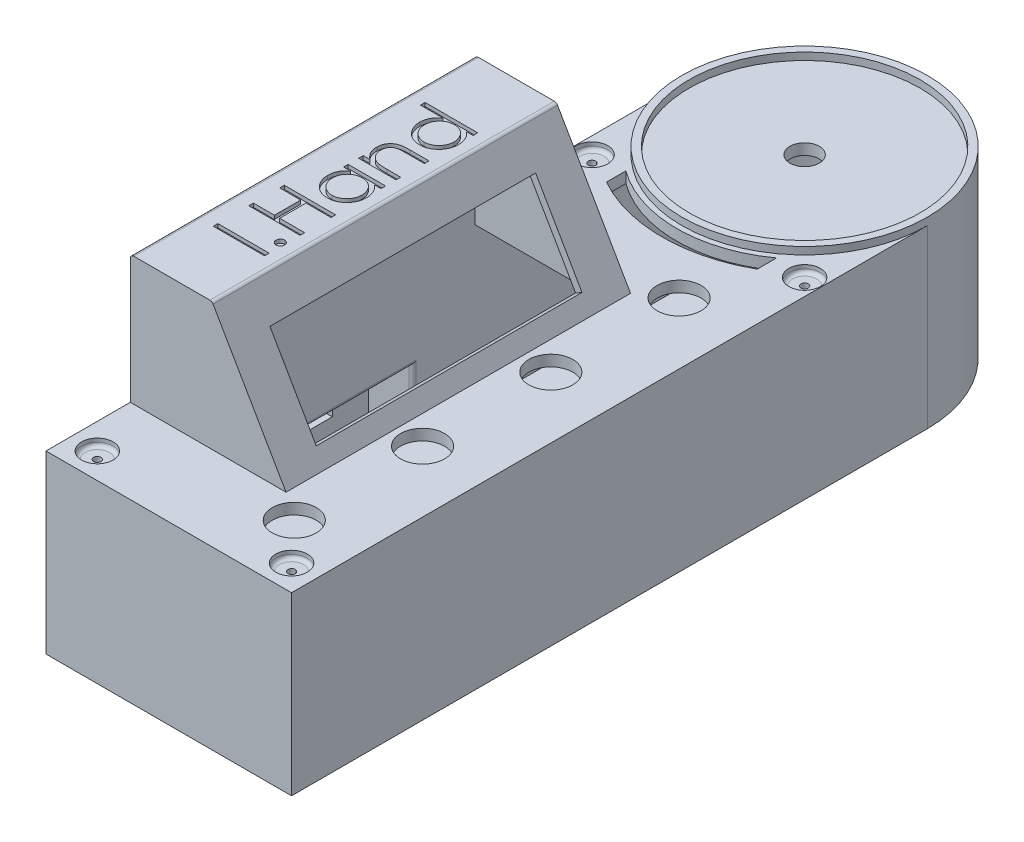
from build123d import *

# Parameters (mm, degrees)
SKETCH4_W                = 63
SKETCH4_H                = 43
BOSS_EXTRUDE2_DEPTH      = 173.5
SKETCH6_R                = 4
CUT_EXTRUDE1_DEPTH       = 3
SKETCH9_W                = 63
SKETCH9_H                = 43
CUT_EXTRUDE2_DEPTH       = 173.5
SKETCH10_R               = 8.2
BOSS_EXTRUDE3_DEPTH      = 22.8
SKETCH11_W               = 63
SKETCH11_H               = 43
BOSS_EXTRUDE4_DEPTH      = 2
SKETCH13_R               = 3
BOSS_EXTRUDE5_DEPTH      = 43
SKETCH14_R               = 1
CUT_EXTRUDE3_DEPTH       = 46
SKETCH15_R               = 4.3
CUT_EXTRUDE4_DEPTH       = 2
FILLET1_R                = 1
SKETCH19_R               = 6
CUT_EXTRUDE5_DEPTH       = 3
BOSS_EXTRUDE6_DEPTH      = 94
SKETCH21_W               = 37.035898385
SKETCH21_H               = 94
CUT_EXTRUDE6_DEPTH       = 13
FILLET2_R                = 1
BOSS_EXTRUDE8_DEPTH      = 2
SKETCH23_W               = 72.5
SKETCH23_H               = 25.3
CUT_EXTRUDE7_DEPTH       = 2
BOSS_EXTRUDE9_START      = -2
BOSS_EXTRUDE9_DEPTH      = 2
SKETCH25_R               = 3
BOSS_EXTRUDE10_DEPTH     = 48
SKETCH26_R               = 1
CUT_EXTRUDE8_DEPTH       = 46
SKETCH27_R               = 4.3
CUT_EXTRUDE9_DEPTH       = 2
FILLET3_R                = 1
SKETCH30_W               = 56
SKETCH30_H               = 18
CUT_EXTRUDE10_DEPTH      = 2
SKETCH31_W               = 60
SKETCH31_H               = 22
SKETCH31_W_2             = 56
SKETCH31_H_2             = 18
BOSS_EXTRUDE11_DEPTH     = 12
FILLET4_R                = 1
SKETCH33_W               = 56
SKETCH33_H               = 18
BOSS_EXTRUDE12_DEPTH     = 2
SKETCH34_W               = 1.256410256
SKETCH34_H               = 14
CUT_EXTRUDE11_DEPTH      = 1
SKETCH35_W               = 13.1
SKETCH35_H               = 12
SKETCH35_W_2             = 9.9
SKETCH35_H_2             = 11.8
CUT_EXTRUDE12_DEPTH      = 2
FILLET5_R                = 1
CUT_EXTRUDE13_DEPTH      = 186.67848556
CUT_EXTRUDE13_DEPTH_BACK = 3
FILLET6_R                = 1
SKETCH37_W               = 140.841687605
SKETCH37_H               = 2
BOSS_EXTRUDE13_DEPTH     = 4
FILLET8_R                = 2


with BuildPart() as part:
    # Sketch1 → Revolve1 (revolve)
    with BuildSketch(Plane.XY, mode=Mode.PRIVATE) as revolve1_sk:
        Polygon((-31.5, 48), (-31.5, 50), (-33.5, 50), (-33.5, 0), (0, 0), (0, 24.8), (-8.2, 24.8), (-8.2, 2), (-31.5, 2), (-31.5, 45), (-4, 45), (-4, 48), align=None)
    revolve(revolve1_sk.sketch.rotate(Axis((0, 0, 0), (0, 1, 0)), 270), axis=Axis((0, 0, 0), (0, 1, 0)))

    # Sketch4 → Boss-Extrude2 (add)
    with BuildSketch(Plane.XY):
        Polygon((33.5, 0), (-33.5, 0), (-33.5, 48), (-31.5, 48), (31.5, 48), (33.5, 48), align=None)
        with Locations((0, 23.5)):
            Rectangle(SKETCH4_W, SKETCH4_H, mode=Mode.SUBTRACT)
    extrude(amount=BOSS_EXTRUDE2_DEPTH)

    # Sketch6 → Cut-Extrude1 (cut)
    with BuildSketch(Plane(origin=(0, 48, 0), x_dir=(1, 0, 0), z_dir=(0, 1, 0))):
        with Locations(Location((0, 0, 0), (0, 0, 90))):
            Circle(SKETCH6_R)
    extrude(amount=-CUT_EXTRUDE1_DEPTH, mode=Mode.SUBTRACT)

    # Sketch9 → Cut-Extrude2 (cut)
    with BuildSketch(Plane.XY.offset(173.5)):
        with Locations((0, 23.5)):
            Rectangle(SKETCH9_W, SKETCH9_H)
    extrude(amount=-CUT_EXTRUDE2_DEPTH, mode=Mode.SUBTRACT)

    # Sketch10 → Boss-Extrude3 (add)
    with BuildSketch(Plane(origin=(0, 2, 0), x_dir=(1, 0, 0), z_dir=(0, 1, 0))):
        with Locations(Location((0, 0, 0), (0, 0, 90))):
            Circle(SKETCH10_R)
    extrude(amount=BOSS_EXTRUDE3_DEPTH)

    # Sketch11 → Boss-Extrude4 (add)
    with BuildSketch(Plane.XY.offset(173.5)):
        with Locations((0, 23.5)):
            Rectangle(SKETCH11_W, SKETCH11_H)
    extrude(amount=-BOSS_EXTRUDE4_DEPTH)

    # Sketch13 → Boss-Extrude5 (add)
    with BuildSketch(Plane(origin=(0, 2, 0), x_dir=(1, 0, 0), z_dir=(0, 1, 0))):
        with Locations(Location((-26.5, -166.5, 0), (0, 0, 90))):
            Circle(SKETCH13_R)
        with Locations(Location((26.5, -166.5, 0), (0, 0, 90))):
            Circle(SKETCH13_R)
    extrude(amount=BOSS_EXTRUDE5_DEPTH)

    # Sketch14 → Cut-Extrude3 (cut)
    with BuildSketch(Plane(origin=(0, 2, 0), x_dir=(1, 0, 0), z_dir=(0, 1, 0))):
        with Locations(Location((-26.5, -166.5, 0), (0, 0, 270))):
            Circle(SKETCH14_R)
        with Locations(Location((26.5, -166.5, 0), (0, 0, 270))):
            Circle(SKETCH14_R)
    extrude(amount=CUT_EXTRUDE3_DEPTH, mode=Mode.SUBTRACT)

    # Sketch15 → Cut-Extrude4 (cut)
    with BuildSketch(Plane(origin=(0, 48, 0), x_dir=(1, 0, 0), z_dir=(0, 1, 0))):
        with Locations(Location((-26.5, -166.5, 0), (0, 0, 270))):
            Circle(SKETCH15_R)
        with Locations(Location((26.5, -166.5, 0), (0, 0, 270))):
            Circle(SKETCH15_R)
    extrude(amount=-CUT_EXTRUDE4_DEPTH, mode=Mode.SUBTRACT)

    # Fillet1
    fillet1_edges = [part.edges().sort_by_distance(p)[0] for p in [
        (-26.5, 46, 162.2),
        (26.5, 46, 162.2),
    ]]
    fillet(fillet1_edges, radius=FILLET1_R)

    # Sketch19 → Cut-Extrude5 (cut)
    with BuildSketch(Plane(origin=(0, 48, 0), x_dir=(1, 0, 0), z_dir=(0, 1, 0))):
        with Locations(Location((16.75, -51, 0), (0, 0, 270))):
            Circle(SKETCH19_R)
        with Locations(Location((16.75, -86, 0), (0, 0, 270))):
            Circle(SKETCH19_R)
        with Locations(Location((16.75, -121, 0), (0, 0, 270))):
            Circle(SKETCH19_R)
        with Locations(Location((16.75, -156, 0), (0, 0, 270))):
            Circle(SKETCH19_R)
    extrude(amount=-CUT_EXTRUDE5_DEPTH, mode=Mode.SUBTRACT)

    # Sketch20 → Boss-Extrude6 (add)
    with BuildSketch(Plane.XY.offset(56.5)):
        Polygon((9, 48), (-11.207259422, 83), (-33.5, 83), (-33.5, 48), align=None)
        Polygon((5.535898385, 50), (-12.36195996, 81), (-31.5, 81), (-31.5, 50), align=None, mode=Mode.SUBTRACT)
    extrude(amount=BOSS_EXTRUDE6_DEPTH)

    # Sketch21 → Cut-Extrude6 (cut)
    with BuildSketch(Plane(origin=(0, 50, 0), x_dir=(1, 0, 0), z_dir=(0, 1, 0))):
        with Locations((-12.982050808, -103.5)):
            Rectangle(SKETCH21_W, SKETCH21_H)
    extrude(amount=-CUT_EXTRUDE6_DEPTH, mode=Mode.SUBTRACT)

    # Fillet2
    fillet2_edges = [part.edges().sort_by_distance(p)[0] for p in [
        (-11.207259422, 83, 103.5),
        (-33.5, 83, 103.5),
    ]]
    fillet(fillet2_edges, radius=FILLET2_R)

    # Sketch22 → Boss-Extrude8 (add)
    with BuildSketch(Plane.XY.offset(150.5)):
        with BuildLine():
            Line((-33.5, 48), (-33.5, 45))
            Line((-33.5, 45), (9, 45))
            Line((9, 45), (9, 48))
            Line((9, 48), (-10.918584287, 82.5))
            ThreePointArc((-10.918584287, 82.5), (-11.284609691, 82.866025404), (-11.784609691, 83))
            Line((-11.784609691, 83), (-32.5, 83))
            ThreePointArc((-32.5, 83), (-33.207106781, 82.707106781), (-33.5, 82))
            Line((-33.5, 82), (-33.5, 48))
        make_face()
    extrude(amount=-BOSS_EXTRUDE8_DEPTH)

    # Sketch23 → Cut-Extrude7 (cut)
    with BuildSketch(Plane(origin=(27.534609691, 15.897114317, 0), x_dir=(0, 0, -1), z_dir=(0.8660254037844364, 0.5000000000000041, 0))):
        with Locations((-103.5, 54.719219382)):
            Rectangle(SKETCH23_W, SKETCH23_H)
    extrude(amount=-CUT_EXTRUDE7_DEPTH, mode=Mode.SUBTRACT)

    # Sketch24 → Boss-Extrude9 (add)
    with BuildSketch(Plane(origin=(0, 0, 56.5), x_dir=(-1, 0, 0), z_dir=(0, 0, -1)).offset(BOSS_EXTRUDE9_START)):
        with BuildLine():
            Line((-9, 48), (-9, 45))
            Line((-9, 45), (33.5, 45))
            Line((33.5, 45), (33.5, 82))
            ThreePointArc((33.5, 82), (33.207106781, 82.707106781), (32.5, 83))
            Line((32.5, 83), (11.784609691, 83))
            ThreePointArc((11.784609691, 83), (11.284609691, 82.866025404), (10.918584287, 82.5))
            Line((10.918584287, 82.5), (-9, 48))
        make_face()
    extrude(amount=BOSS_EXTRUDE9_DEPTH)

    # Sketch25 → Boss-Extrude10 (add)
    with BuildSketch(Plane(origin=(0, 48, 0), x_dir=(1, 0, 0), z_dir=(0, 1, 0))):
        with Locations((29, -29)):
            Circle(SKETCH25_R)
        with Locations((-29, -29)):
            Circle(SKETCH25_R)
    extrude(amount=-BOSS_EXTRUDE10_DEPTH)

    # Sketch26 → Cut-Extrude8 (cut)
    with BuildSketch(Plane(origin=(0, 48, 0), x_dir=(1, 0, 0), z_dir=(0, 1, 0))):
        with Locations(Location((29, -29, 0), (0, 0, 270))):
            Circle(SKETCH26_R)
        with Locations(Location((-29, -29, 0), (0, 0, 270))):
            Circle(SKETCH26_R)
    extrude(amount=-CUT_EXTRUDE8_DEPTH, mode=Mode.SUBTRACT)

    # Sketch27 → Cut-Extrude9 (cut)
    with BuildSketch(Plane(origin=(0, 48, 0), x_dir=(1, 0, 0), z_dir=(0, 1, 0))):
        with Locations(Location((-29, -29, 0), (0, 0, 270))):
            Circle(SKETCH27_R)
        with Locations(Location((29, -29, 0), (0, 0, 270))):
            Circle(SKETCH27_R)
    extrude(amount=-CUT_EXTRUDE9_DEPTH, mode=Mode.SUBTRACT)

    # Fillet3
    fillet3_edges = [part.edges().sort_by_distance(p)[0] for p in [
        (-29, 46, 24.7),
        (29, 46, 24.7),
    ]]
    fillet(fillet3_edges, radius=FILLET3_R)

    # Sketch30 → Cut-Extrude10 (cut)
    with BuildSketch(Plane.ZY.offset(33.5)):
        with Locations((103.5, 11)):
            Rectangle(SKETCH30_W, SKETCH30_H)
    extrude(amount=-CUT_EXTRUDE10_DEPTH, mode=Mode.SUBTRACT)

    # Sketch31 → Boss-Extrude11 (add)
    with BuildSketch(Plane.ZY.offset(33.5)):
        with Locations((103.5, 11)):
            Rectangle(SKETCH31_W, SKETCH31_H)
        with Locations((103.5, 11)):
            Rectangle(SKETCH31_W_2, SKETCH31_H_2, mode=Mode.SUBTRACT)
    extrude(amount=BOSS_EXTRUDE11_DEPTH)

    # Fillet4
    fillet4_edges = [part.edges().sort_by_distance(p)[0] for p in [
        (-33.5, 22, 103.5),
        (-33.5, 11, 73.5),
        (-33.5, 11, 133.5),
    ]]
    fillet(fillet4_edges, radius=FILLET4_R)

    # Sketch33 → Boss-Extrude12 (add)
    with BuildSketch(Plane.ZY.offset(45.5)):
        with Locations((103.5, 11)):
            Rectangle(SKETCH33_W, SKETCH33_H)
    extrude(amount=-BOSS_EXTRUDE12_DEPTH)

    # Sketch34 → Cut-Extrude11 (cut)
    # profile 1 of 6: a face of its own
    with BuildSketch(Plane(origin=(-88.690997647, 83, 0), x_dir=(0, 0, -1), z_dir=(0, -1, 0))):
        with Locations((-131.948717949, 66.906387956)):
            Rectangle(SKETCH34_W, SKETCH34_H)
    # profile 2 of 6: a face of its own
    with BuildSketch(Plane(origin=(-88.690997647, 83, 0), x_dir=(0, 0, -1), z_dir=(0, -1, 0))):
        with BuildLine():
            add(Edge.make_bspline(
                [(-127.282051282, 71.752541802), (-127.204036474, 71.757021384), (-127.05199672, 71.765751451), (-126.831838559, 71.829913099), (-126.630653738, 71.938172272), (-126.452556555, 72.086921483), (-126.304534975, 72.264507803), (-126.195030127, 72.46518156), (-126.127927486, 72.68597799), (-126.119633012, 72.84021095), (-126.115384615, 72.919208469)],
                knots=[0, 0, 0, 0, 1.020591893, 1.988988293, 2.974634352, 3.991697318, 5.008760285, 5.983632262, 6.967224335, 8, 8, 8, 8], degree=3))
            add(Edge.make_bspline(
                [(-126.115384615, 72.919208469), (-126.119787901, 72.996319721), (-126.128486105, 73.148644483), (-126.195061577, 73.367578068), (-126.30439614, 73.56847965), (-126.453493838, 73.745645733), (-126.6295776, 73.897974931), (-126.832476342, 74.004732003), (-127.051429094, 74.073595456), (-127.203934167, 74.081715722), (-127.282051282, 74.085875135)],
                knots=[0, 0, 0, 0, 1.010056097, 1.99525427, 2.971718109, 3.990441831, 5.01702829, 6.004283803, 6.977741589, 8, 8, 8, 8], degree=3))
            add(Edge.make_bspline(
                [(-127.282051282, 74.085875135), (-127.360112179, 74.081559045), (-127.513404007, 74.073083337), (-127.73317612, 74.006101082), (-127.934845679, 73.896933206), (-128.11097521, 73.745920643), (-128.258874388, 73.567557044), (-128.373284839, 73.368945884), (-128.434548495, 73.148011315), (-128.443950276, 72.996195002), (-128.448717949, 72.919208469)],
                knots=[0, 0, 0, 0, 1.021821805, 2.006599202, 2.982645994, 4.008793999, 5.027082625, 6.009034913, 6.990375297, 8, 8, 8, 8], degree=3))
            add(Edge.make_bspline(
                [(-128.448717949, 72.919208469), (-128.444092294, 72.840340078), (-128.435076647, 72.686621378), (-128.373312706, 72.463815008), (-128.258735298, 72.265431373), (-128.111909392, 72.086648721), (-127.933780412, 71.939197607), (-127.733801774, 71.828562965), (-127.51284526, 71.76625627), (-127.360012131, 71.757174469), (-127.282051282, 71.752541802)],
                knots=[0, 0, 0, 0, 1.032329927, 2.012066096, 2.992413168, 4.009037178, 5.025661188, 6.000112418, 6.979848586, 8, 8, 8, 8], degree=3))
        make_face()
    # profile 3 of 6: a face of its own
    with BuildSketch(Plane(origin=(-88.690997647, 83, 0), x_dir=(0, 0, -1), z_dir=(0, -1, 0))):
        Polygon((-122.884615385, 59.906387956), (-121.628205128, 59.906387956), (-121.628205128, 65.649977699), (-114.448717949, 65.649977699), (-114.448717949, 59.906387956), (-113.192307692, 59.906387956), (-113.192307692, 73.906387956), (-114.448717949, 73.906387956), (-114.448717949, 67.085875135), (-121.628205128, 67.085875135), (-121.628205128, 73.906387956), (-122.884615385, 73.906387956), align=None)
    # profile 4 of 6: a face of its own
    with BuildSketch(Plane(origin=(-88.690997647, 83, 0), x_dir=(0, 0, -1), z_dir=(0, -1, 0))):
        with BuildLine():
            Line((-99.551282051, 63.675618725), (-99.551282051, 73.906387956))
            Line((-99.551282051, 73.906387956), (-100.807692308, 73.906387956))
            Line((-100.807692308, 73.906387956), (-100.807692308, 72.136756545))
            add(Edge.make_bspline(
                [(-100.807692308, 72.136756545), (-100.949559408, 72.296694095), (-101.226826553, 72.609278391), (-101.685478933, 73.020163), (-102.175666693, 73.355630058), (-102.689038567, 73.627929327), (-103.229568228, 73.833193668), (-103.794081172, 73.977799853), (-104.382135708, 74.071868231), (-104.783157032, 74.081164279), (-104.986378205, 74.085875135)],
                knots=[0, 0, 0, 0, 1.074235403, 2.099501444, 3.086304576, 4.053325556, 5.01427503, 5.985443889, 6.979105517, 8, 8, 8, 8], degree=3))
            add(Edge.make_bspline(
                [(-104.986378205, 74.085875135), (-105.167050511, 74.08097046), (-105.523344299, 74.071298224), (-106.047453548, 73.996237304), (-106.551848614, 73.875758039), (-107.036850958, 73.707995401), (-107.499174292, 73.486612277), (-107.941423686, 73.21870812), (-108.36463127, 72.902801794), (-108.760748522, 72.540247251), (-109.125978444, 72.14687795), (-109.445517738, 71.726092193), (-109.716337693, 71.283669461), (-109.938903193, 70.8197341), (-110.111136046, 70.334625248), (-110.23096351, 69.828675698), (-110.305943543, 69.302727324), (-110.315610879, 68.944567704), (-110.320512821, 68.762958469)],
                knots=[0, 0, 0, 0, 1.034036272, 2.039165313, 3.024406509, 3.999331371, 4.971254918, 5.953351348, 6.95522652, 7.989525907, 9.023492927, 10.024309745, 11.009187477, 11.988246066, 12.964946762, 13.950187958, 14.960617622, 16, 16, 16, 16], degree=3))
            add(Edge.make_bspline(
                [(-110.320512821, 68.762958469), (-110.315502156, 68.585102896), (-110.305596342, 68.233492024), (-110.23176582, 67.716388188), (-110.107706917, 67.2182747), (-109.933274241, 66.740996758), (-109.710590389, 66.282632207), (-109.435112943, 65.846767298), (-109.115688796, 65.426734526), (-108.74655549, 65.036003596), (-108.34688294, 64.676390503), (-107.921307552, 64.359716463), (-107.475135823, 64.092499188), (-107.007473118, 63.875277522), (-106.5216309, 63.702659962), (-106.013918487, 63.582328903), (-105.48664475, 63.511593502), (-105.128686543, 63.501335053), (-104.947115385, 63.496131545)],
                knots=[0, 0, 0, 0, 1.02050356, 2.017480486, 2.990790918, 3.96161403, 4.928589988, 5.909588639, 6.91611943, 7.952353252, 8.989586576, 9.99823133, 10.991940466, 11.968822692, 12.952985106, 13.945868367, 14.958059758, 16, 16, 16, 16], degree=3))
            add(Edge.make_bspline(
                [(-104.947115385, 63.496131545), (-104.738311782, 63.501860959), (-104.328857772, 63.513096067), (-103.729112136, 63.607392592), (-103.161484658, 63.765224909), (-102.621058799, 63.980649759), (-102.115429291, 64.270750367), (-101.639735311, 64.629702222), (-101.199621142, 65.066207485), (-100.9405952, 65.398270363), (-100.807692308, 65.568647571)],
                knots=[0, 0, 0, 0, 1.038908319, 2.037250181, 3.012632028, 3.966567879, 4.9252131, 5.905168122, 6.925168603, 8, 8, 8, 8], degree=3))
            Line((-100.807692308, 65.568647571), (-100.807692308, 63.675618725))
            Line((-100.807692308, 63.675618725), (-99.551282051, 63.675618725))
        make_face()
        with BuildLine():
            add(Edge.make_bspline(
                [(-104.930288462, 64.752541802), (-105.113941971, 64.759081875), (-105.476444788, 64.771990938), (-106.008676356, 64.872605062), (-106.517721233, 65.040443519), (-107.002751616, 65.268659247), (-107.450376696, 65.560996553), (-107.857064896, 65.905684904), (-108.211791596, 66.306947393), (-108.511723002, 66.755564948), (-108.760721655, 67.233621452), (-108.932550065, 67.737000467), (-109.046679273, 68.252096677), (-109.058279678, 68.601563937), (-109.064102564, 68.776980904)],
                knots=[0, 0, 0, 0, 1.031179624, 2.035384561, 3.030098214, 4.035455833, 5.037557836, 6.024646278, 7.02156144, 8.035264006, 9.049836703, 10.039645228, 11.015989397, 12, 12, 12, 12], degree=3))
            add(Edge.make_bspline(
                [(-109.064102564, 68.776980904), (-109.05654374, 68.951306689), (-109.04145572, 69.299274959), (-108.936056281, 69.815160534), (-108.751049717, 70.315255398), (-108.507497803, 70.799474277), (-108.202845091, 71.251438033), (-107.848818519, 71.660109619), (-107.440066701, 72.010111329), (-106.988500009, 72.303274908), (-106.506714423, 72.539101452), (-105.999879604, 72.705430661), (-105.476829524, 72.810449466), (-105.120547678, 72.823105087), (-104.94150641, 72.829464879)],
                knots=[0, 0, 0, 0, 0.979235476, 1.954632679, 2.943119654, 3.967171814, 4.992637064, 5.997548408, 6.995574264, 8.005058949, 9.015076297, 9.999929117, 10.994910263, 12, 12, 12, 12], degree=3))
            add(Edge.make_bspline(
                [(-104.94150641, 72.829464879), (-104.759723293, 72.82284818), (-104.399094225, 72.809721692), (-103.865022351, 72.708413684), (-103.347692816, 72.538491195), (-102.851318684, 72.307106954), (-102.389689733, 72.020246776), (-101.97729874, 71.682924863), (-101.621032586, 71.296628225), (-101.327706123, 70.863665084), (-101.093342241, 70.394243496), (-100.927394835, 69.892855662), (-100.826604225, 69.362481009), (-100.814083445, 68.998983698), (-100.807692308, 68.813439238)],
                knots=[0, 0, 0, 0, 1.017730373, 2.019016736, 3.032373701, 4.060729657, 5.079187105, 6.068726676, 7.03591854, 8.011858086, 8.988317194, 9.965225429, 10.961364673, 12, 12, 12, 12], degree=3))
            add(Edge.make_bspline(
                [(-100.807692308, 68.813439238), (-100.811530994, 68.67208797), (-100.819086743, 68.393863944), (-100.876808154, 67.985353095), (-100.968631033, 67.594421044), (-101.098004164, 67.220639903), (-101.268012245, 66.866138453), (-101.472841465, 66.528137895), (-101.716693177, 66.209786658), (-101.992146351, 65.911487906), (-102.297054473, 65.64077053), (-102.621284743, 65.402162507), (-102.964021402, 65.200234462), (-103.325023868, 65.038639209), (-103.701511674, 64.906991608), (-104.097093385, 64.820040643), (-104.507782261, 64.760144848), (-104.787970212, 64.755102835), (-104.930288462, 64.752541802)],
                knots=[0, 0, 0, 0, 1.050062701, 2.066855696, 3.059271411, 4.030305351, 4.999747758, 5.975466543, 6.961907836, 7.974539719, 8.98812422, 9.98710676, 10.961662635, 11.93785114, 12.922015094, 13.919620009, 14.94329489, 16, 16, 16, 16], degree=3))
        make_face(mode=Mode.SUBTRACT)
    # profile 5 of 6: a face of its own
    with BuildSketch(Plane(origin=(-88.690997647, 83, 0), x_dir=(0, 0, -1), z_dir=(0, -1, 0))):
        with BuildLine():
            Line((-96.679487179, 63.675618725), (-95.423076923, 63.675618725))
            Line((-95.423076923, 63.675618725), (-95.423076923, 65.520971289))
            add(Edge.make_bspline(
                [(-95.423076923, 65.520971289), (-95.289157957, 65.353350137), (-95.029691705, 65.02858634), (-94.59314516, 64.60509757), (-94.137956996, 64.249722748), (-93.656734238, 63.969916172), (-93.154428772, 63.758297763), (-92.632465882, 63.605695951), (-92.088020434, 63.514140011), (-91.717760861, 63.502181358), (-91.530448718, 63.496131545)],
                knots=[0, 0, 0, 0, 1.127869841, 2.185233117, 3.191641716, 4.159226741, 5.10472073, 6.052603964, 7.014823782, 8, 8, 8, 8], degree=3))
            add(Edge.make_bspline(
                [(-91.530448718, 63.496131545), (-91.341035811, 63.502717968), (-90.970123229, 63.515615649), (-90.432020324, 63.629261075), (-89.925930257, 63.809105693), (-89.458620286, 64.061868442), (-89.037280928, 64.375689687), (-88.671907889, 64.743804343), (-88.364647734, 65.161777592), (-88.15956584, 65.553010358), (-88.02692105, 65.900525254), (-87.939752105, 66.197763901), (-87.869230571, 66.529058154), (-87.806040534, 66.893588904), (-87.763885841, 67.292820282), (-87.730470414, 67.725799431), (-87.706569282, 68.192451381), (-87.705618498, 68.515197399), (-87.705128205, 68.68162834)],
                knots=[0, 0, 0, 0, 1.235764162, 2.419900973, 3.574701258, 4.732869372, 5.875730734, 6.993815468, 8.107424371, 9.251605764, 9.866123335, 10.534503958, 11.272175692, 12.077112099, 12.949509943, 13.89253218, 14.913238789, 16, 16, 16, 16], degree=3))
            Line((-87.705128205, 68.68162834), (-87.705128205, 73.906387956))
            Line((-87.705128205, 73.906387956), (-88.961538462, 73.906387956))
            Line((-88.961538462, 73.906387956), (-88.961538462, 69.093887956))
            add(Edge.make_bspline(
                [(-88.961538462, 69.093887956), (-88.962308095, 68.954597976), (-88.963780274, 68.68815995), (-88.968484365, 68.306686454), (-88.979557576, 67.961664657), (-88.995757207, 67.652102998), (-89.018432601, 67.379134492), (-89.042707021, 67.141377431), (-89.07214832, 66.940937808), (-89.098401967, 66.820277635), (-89.110176282, 66.766163597)],
                knots=[0, 0, 0, 0, 1.430803381, 2.736883362, 3.918614142, 4.976458302, 5.92063272, 6.731858525, 7.431260095, 8, 8, 8, 8], degree=3))
            add(Edge.make_bspline(
                [(-89.110176282, 66.766163597), (-89.152467435, 66.60720474), (-89.233648341, 66.302071799), (-89.438328407, 65.888890398), (-89.69079908, 65.534265166), (-90.003604456, 65.245489432), (-90.368343351, 65.020684953), (-90.785622116, 64.864823406), (-91.251122123, 64.767308391), (-91.578541768, 64.757601307), (-91.749198718, 64.752541802)],
                knots=[0, 0, 0, 0, 1.084232, 2.08126119, 3.027460722, 3.945137793, 4.874029258, 5.839697328, 6.874011781, 8, 8, 8, 8], degree=3))
            add(Edge.make_bspline(
                [(-91.749198718, 64.752541802), (-91.850278792, 64.754417715), (-92.050313648, 64.758130098), (-92.346777346, 64.796345108), (-92.635253712, 64.856700904), (-92.914969902, 64.945850548), (-93.186491199, 65.05424406), (-93.450941222, 65.187247995), (-93.70462484, 65.348127535), (-93.951109207, 65.528956343), (-94.180206001, 65.730331925), (-94.396414837, 65.939748523), (-94.58638105, 66.165974926), (-94.758817282, 66.401012527), (-94.907487653, 66.649582736), (-95.037311441, 66.90902848), (-95.147451161, 67.179760147), (-95.202182341, 67.367659979), (-95.229567308, 67.461676417)],
                knots=[0, 0, 0, 0, 1.023939463, 2.026349741, 3.024227553, 4.007104963, 4.997624259, 5.984875705, 7.002218968, 8.038748769, 9.079772093, 10.091408226, 11.086177727, 12.069739863, 13.043026652, 14.017557731, 15.008077027, 16, 16, 16, 16], degree=3))
            add(Edge.make_bspline(
                [(-95.229567308, 67.461676417), (-95.245325902, 67.530697229), (-95.279631537, 67.680951927), (-95.316684257, 67.927529605), (-95.350314558, 68.212769505), (-95.378462393, 68.536338773), (-95.395684059, 68.899370273), (-95.414461646, 69.300313625), (-95.42129789, 69.740767578), (-95.422467306, 70.047414349), (-95.423076923, 70.207269366)],
                knots=[0, 0, 0, 0, 0.615963638, 1.340920617, 2.168419149, 3.115676021, 4.16674242, 5.331190069, 6.6087489, 8, 8, 8, 8], degree=3))
            Line((-95.423076923, 70.207269366), (-95.423076923, 73.906387956))
            Line((-95.423076923, 73.906387956), (-96.679487179, 73.906387956))
            Line((-96.679487179, 73.906387956), (-96.679487179, 63.675618725))
        make_face()
    # profile 6 of 6: a face of its own
    with BuildSketch(Plane(origin=(-88.690997647, 83, 0), x_dir=(0, 0, -1), z_dir=(0, -1, 0))):
        with BuildLine():
            Line((-74.423076923, 59.547413597), (-74.423076923, 73.906387956))
            Line((-74.423076923, 73.906387956), (-75.679487179, 73.906387956))
            Line((-75.679487179, 73.906387956), (-75.679487179, 72.136756545))
            add(Edge.make_bspline(
                [(-75.679487179, 72.136756545), (-75.82135428, 72.296694095), (-76.098621425, 72.609278391), (-76.557273805, 73.020163), (-77.047461565, 73.355630058), (-77.560833439, 73.627929327), (-78.101363099, 73.833193668), (-78.665876043, 73.977799853), (-79.25393058, 74.071868231), (-79.654951904, 74.081164279), (-79.858173077, 74.085875135)],
                knots=[0, 0, 0, 0, 1.074235403, 2.099501444, 3.086304576, 4.053325556, 5.01427503, 5.985443889, 6.979105517, 8, 8, 8, 8], degree=3))
            add(Edge.make_bspline(
                [(-79.858173077, 74.085875135), (-80.038845383, 74.08097046), (-80.395139171, 74.071298224), (-80.91924842, 73.996237304), (-81.423643486, 73.875758039), (-81.90864583, 73.707995401), (-82.370969164, 73.486612277), (-82.813218558, 73.21870812), (-83.236426142, 72.902801794), (-83.632543394, 72.540247251), (-83.997773316, 72.14687795), (-84.31731261, 71.726092193), (-84.588132565, 71.283669461), (-84.810698064, 70.8197341), (-84.982930918, 70.334625248), (-85.102758382, 69.828675698), (-85.177738414, 69.302727324), (-85.187405751, 68.944567704), (-85.192307692, 68.762958469)],
                knots=[0, 0, 0, 0, 1.034036272, 2.039165313, 3.024406509, 3.999331371, 4.971254918, 5.953351348, 6.95522652, 7.989525907, 9.023492927, 10.024309745, 11.009187477, 11.988246066, 12.964946762, 13.950187958, 14.960617622, 16, 16, 16, 16], degree=3))
            add(Edge.make_bspline(
                [(-85.192307692, 68.762958469), (-85.187297028, 68.585102896), (-85.177391214, 68.233492024), (-85.103560692, 67.716388188), (-84.979501789, 67.2182747), (-84.805069113, 66.740996758), (-84.582385261, 66.282632207), (-84.306907815, 65.846767298), (-83.987483668, 65.426734526), (-83.618350361, 65.036003596), (-83.218677812, 64.676390503), (-82.793102423, 64.359716463), (-82.346930695, 64.092499188), (-81.879267989, 63.875277522), (-81.393425772, 63.702659962), (-80.885713359, 63.582328903), (-80.358439621, 63.511593502), (-80.000481415, 63.501335053), (-79.818910256, 63.496131545)],
                knots=[0, 0, 0, 0, 1.02050356, 2.017480486, 2.990790918, 3.96161403, 4.928589988, 5.909588639, 6.91611943, 7.952353252, 8.989586576, 9.99823133, 10.991940466, 11.968822692, 12.952985106, 13.945868367, 14.958059758, 16, 16, 16, 16], degree=3))
            add(Edge.make_bspline(
                [(-79.818910256, 63.496131545), (-79.610011355, 63.502290764), (-79.199966026, 63.514380625), (-78.600202205, 63.618863482), (-78.030823851, 63.786104789), (-77.49185283, 64.023662608), (-76.98802002, 64.333257117), (-76.512590236, 64.705577492), (-76.072848113, 65.149983962), (-75.812606589, 65.484482914), (-75.679487179, 65.655586674)],
                knots=[0, 0, 0, 0, 1.03083325, 2.023411113, 2.996083796, 3.9549903, 4.922369457, 5.908572979, 6.930187902, 8, 8, 8, 8], degree=3))
            Line((-75.679487179, 65.655586674), (-75.679487179, 59.547413597))
            Line((-75.679487179, 59.547413597), (-74.423076923, 59.547413597))
        make_face()
        with BuildLine():
            add(Edge.make_bspline(
                [(-79.802083333, 64.752541802), (-79.985736843, 64.759081875), (-80.34823966, 64.771990938), (-80.880471228, 64.872605062), (-81.389516104, 65.040443519), (-81.874546487, 65.268659247), (-82.322171568, 65.560996553), (-82.728859768, 65.905684904), (-83.083586468, 66.306947393), (-83.383517874, 66.755564948), (-83.632516527, 67.233621452), (-83.804344936, 67.737000467), (-83.918474145, 68.252096677), (-83.93007455, 68.601563937), (-83.935897436, 68.776980904)],
                knots=[0, 0, 0, 0, 1.031179624, 2.035384561, 3.030098214, 4.035455833, 5.037557836, 6.024646278, 7.02156144, 8.035264006, 9.049836703, 10.039645228, 11.015989397, 12, 12, 12, 12], degree=3))
            add(Edge.make_bspline(
                [(-83.935897436, 68.776980904), (-83.928338612, 68.951306689), (-83.913250592, 69.299274959), (-83.807851153, 69.815160534), (-83.622844589, 70.315255398), (-83.379292675, 70.799474277), (-83.074639963, 71.251438033), (-82.72061339, 71.660109619), (-82.311861573, 72.010111329), (-81.860294881, 72.303274908), (-81.378509295, 72.539101452), (-80.871674476, 72.705430661), (-80.348624396, 72.810449466), (-79.99234255, 72.823105087), (-79.813301282, 72.829464879)],
                knots=[0, 0, 0, 0, 0.979235476, 1.954632679, 2.943119654, 3.967171814, 4.992637064, 5.997548408, 6.995574264, 8.005058949, 9.015076297, 9.999929117, 10.994910263, 12, 12, 12, 12], degree=3))
            add(Edge.make_bspline(
                [(-79.813301282, 72.829464879), (-79.631518165, 72.82284818), (-79.270889097, 72.809721692), (-78.736817223, 72.708413684), (-78.219487688, 72.538491195), (-77.723113556, 72.307106954), (-77.261484605, 72.020246776), (-76.849093611, 71.682924863), (-76.492827458, 71.296628225), (-76.199500994, 70.863665084), (-75.965137113, 70.394243496), (-75.799189707, 69.892855662), (-75.698399097, 69.362481009), (-75.685878317, 68.998983698), (-75.679487179, 68.813439238)],
                knots=[0, 0, 0, 0, 1.017730373, 2.019016736, 3.032373701, 4.060729657, 5.079187105, 6.068726676, 7.03591854, 8.011858086, 8.988317194, 9.965225429, 10.961364673, 12, 12, 12, 12], degree=3))
            add(Edge.make_bspline(
                [(-75.679487179, 68.813439238), (-75.683325866, 68.67208797), (-75.690881615, 68.393863944), (-75.748603026, 67.985353095), (-75.840425905, 67.594421044), (-75.969799036, 67.220639903), (-76.139807117, 66.866138453), (-76.344636337, 66.528137895), (-76.588488049, 66.209786658), (-76.863941223, 65.911487906), (-77.168849344, 65.64077053), (-77.493079615, 65.402162507), (-77.835816274, 65.200234462), (-78.19681874, 65.038639209), (-78.573306545, 64.906991608), (-78.968888256, 64.820040643), (-79.379577132, 64.760144848), (-79.659765083, 64.755102835), (-79.802083333, 64.752541802)],
                knots=[0, 0, 0, 0, 1.050062701, 2.066855696, 3.059271411, 4.030305351, 4.999747758, 5.975466543, 6.961907836, 7.974539719, 8.98812422, 9.98710676, 10.961662635, 11.93785114, 12.922015094, 13.919620009, 14.94329489, 16, 16, 16, 16], degree=3))
        make_face(mode=Mode.SUBTRACT)
    extrude(amount=CUT_EXTRUDE11_DEPTH, mode=Mode.SUBTRACT)

    # Sketch35 → Cut-Extrude12 (cut)
    with BuildSketch(Plane.ZY.offset(45.5)):
        with Locations((91.925, 13)):
            Rectangle(SKETCH35_W, SKETCH35_H)
        with Locations((121.825, 12.9)):
            Rectangle(SKETCH35_W_2, SKETCH35_H_2)
    extrude(amount=-CUT_EXTRUDE12_DEPTH, mode=Mode.SUBTRACT)

    # Fillet5
    fillet5_edges = [part.edges().sort_by_distance(p)[0] for p in [
        (-45.5, 22, 103.5),
        (-45.5, 11, 73.5),
        (-45.5, 11, 133.5),
    ]]
    fillet(fillet5_edges, radius=FILLET5_R)

    # Sketch36 → Cut-Extrude13 (cut, two sides: drawn at the far end of the back side and taken through both)
    with BuildSketch(Plane(origin=(0, 48, 0), x_dir=(1, 0, 0), z_dir=(0, 1, 0)).offset(-CUT_EXTRUDE13_DEPTH_BACK)):
        with BuildLine():
            Line((0, -34.893159234), (0, -38.893159234))
            ThreePointArc((0, -38.893159234), (10.633828773, -37.522467598), (20.57248383, -33.5))
            Line((20.57248383, -33.5), (20.57248383, -28.208754037))
            ThreePointArc((20.57248383, -28.208754037), (10.815594803, -33.180137304), (0, -34.893159234))
        make_face()
        with BuildLine():
            ThreePointArc((0, -38.893159234), (-10.633828773, -37.522467598), (-20.57248383, -33.5))
            Line((-20.57248383, -33.5), (-20.57248383, -28.208754037))
            ThreePointArc((-20.57248383, -28.208754037), (-10.815594803, -33.180137304), (0, -34.893159234))
            Line((0, -34.893159234), (0, -38.893159234))
        make_face()
    extrude(amount=CUT_EXTRUDE13_DEPTH + CUT_EXTRUDE13_DEPTH_BACK, mode=Mode.SUBTRACT)

    # Fillet6
    fillet6_edges = [part.edges().sort_by_distance(p)[0] for p in [
        (-31.5, 20, 103.5),
        (-31.5, 11, 131.5),
        (-31.5, 11, 75.5),
    ]]
    fillet(fillet6_edges, radius=FILLET6_R)

    # Sketch37 → Boss-Extrude13 (add)
    with BuildSketch(Plane.ZY.offset(-31.5)):
        with Locations((101.079156197, 34.5)):
            Rectangle(SKETCH37_W, SKETCH37_H)
        with Locations((101.079156197, 30.4)):
            Rectangle(SKETCH37_W, SKETCH37_H)
    extrude(amount=BOSS_EXTRUDE13_DEPTH)

    # Fillet8
    fillet8_edges = [part.edges().sort_by_distance(p)[0] for p in [
        (31.5, 29.4, 101.079156198),
    ]]
    fillet(fillet8_edges, radius=FILLET8_R - 0.0001)  # a hair under: the kernel refuses the full size


solid = part.part
